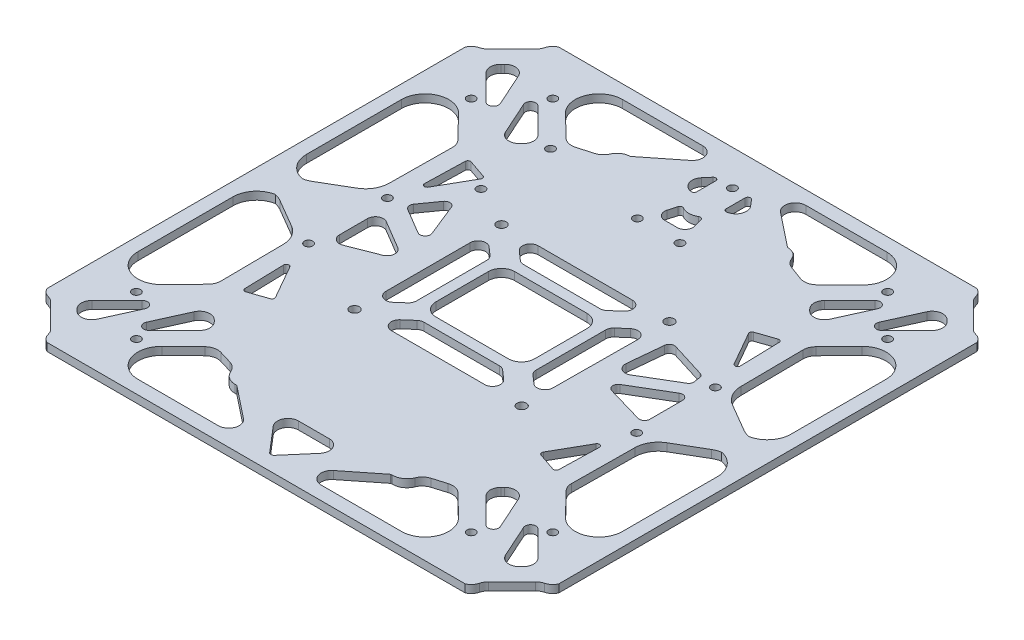
from build123d import *

# Parameters (mm, degrees)
SKETCH2_W                = 195
SKETCH2_H                = 195
BOSS_EXTRUDE1_DEPTH      = 3
CUT_EXTRUDE1_DEPTH       = 138.918454168
CUT_EXTRUDE1_DEPTH_BACK  = 138.918454168
SKETCH3_R                = 1.6
CUT_EXTRUDE2_DEPTH       = 138.918454168
CUT_EXTRUDE2_DEPTH_BACK  = 138.918454168
SKETCH4_R                = 2.11
SKETCH4_R_2              = 1.35
CUT_EXTRUDE3_DEPTH       = 138.918454168
CUT_EXTRUDE3_DEPTH_BACK  = 138.918454168
SKETCH5_R                = 2
CUT_EXTRUDE4_DEPTH       = 138.918454168
CUT_EXTRUDE4_DEPTH_BACK  = 138.918454168
SKETCH6_R                = 1.6
CUT_EXTRUDE5_DEPTH       = 138.918454168
CUT_EXTRUDE5_DEPTH_BACK  = 138.918454168
CUT_EXTRUDE7_DEPTH       = 138.918454168
CUT_EXTRUDE7_DEPTH_BACK  = 138.918454168
SKETCH8_R                = 3
SKETCH9_W                = 5.16198808
SKETCH9_H                = 152.468237428
BOSS_EXTRUDE2_DEPTH      = 3
FILLET1_R                = 9
BOSS_EXTRUDE3_DEPTH      = 3
FILLET2_R                = 9
FILLET3_R                = 4
BOSS_EXTRUDE4_DEPTH      = 3
SKETCH12_W               = 67.185291346
SKETCH12_H               = 7.329006054
SKETCH12_W_2             = 65.807604932
SKETCH12_H_2             = 7.680902366
BOSS_EXTRUDE5_DEPTH      = 3
CUT_EXTRUDE8_DEPTH       = 138.918454168
CUT_EXTRUDE8_DEPTH_BACK  = 138.918454168
SKETCH13_R               = 1.6
SKETCH14_W               = 7.084650063
SKETCH14_H               = 6.320619174
SKETCH14_W_2             = 7.244850247
SKETCH14_H_2             = 7.471829908
SKETCH14_H_3             = 7.337929735
SKETCH14_H_4             = 9.485616487
BOSS_EXTRUDE6_DEPTH      = 3
SKETCH15_W               = 76.15014778
SKETCH15_H               = 29.022259119
BOSS_EXTRUDE7_DEPTH      = 3
CUT_EXTRUDE11_DEPTH      = 138.918454168
CUT_EXTRUDE11_DEPTH_BACK = 138.918454168
SKETCH18_R               = 1.6
SKETCH19_W               = 5.238499816
SKETCH19_H               = 5.48215097
SKETCH19_W_2             = 6.555446642
SKETCH19_H_2             = 6.887367991
SKETCH19_W_3             = 5.693376804
SKETCH19_H_3             = 4.717369352
SKETCH19_W_4             = 5.530708895
SKETCH19_H_4             = 3.253358174
SKETCH19_W_5             = 8.052021565
SKETCH19_H_5             = 7.454416364
SKETCH19_H_6             = 5.907273345
SKETCH19_W_6             = 5.031332607
SKETCH19_H_7             = 4.334328342
SKETCH19_W_7             = 4.364304535
SKETCH19_H_8             = 3.634843179
SKETCH19_W_8             = 5.088021044
SKETCH19_H_9             = 4.815418525
SKETCH19_W_9             = 5.017354085
SKETCH19_H_10            = 5.724023676
SKETCH19_W_10            = 10.097651378
SKETCH19_H_11            = 6.365326346
SKETCH19_W_11            = 13.268814621
SKETCH19_H_12            = 10.097651378
SKETCH19_W_12            = 8.39752449
SKETCH19_H_13            = 7.606810548
SKETCH19_W_13            = 11.084054813
SKETCH19_H_14            = 8.1180962
SKETCH19_W_14            = 4.710280378
SKETCH19_H_15            = 5.7389623
SKETCH19_W_15            = 7.622902871
SKETCH19_H_16            = 6.590378143
SKETCH19_W_16            = 8.877356082
SKETCH19_H_17            = 5.693087053
SKETCH19_W_17            = 11.555067548
SKETCH19_H_18            = 5.886073054
SKETCH19_W_18            = 15.281377101
SKETCH19_H_19            = 7.324501657
SKETCH19_W_19            = 8.760952434
BOSS_EXTRUDE8_DEPTH      = 3
CUT_EXTRUDE13_DEPTH      = 138.918454168
CUT_EXTRUDE13_DEPTH_BACK = 138.918454168
SKETCH21_R               = 1.8
CUT_EXTRUDE14_DEPTH      = 138.918454168
CUT_EXTRUDE14_DEPTH_BACK = 138.918454168
SKETCH22_R               = 1.6
CUT_EXTRUDE15_DEPTH      = 138.918454168
CUT_EXTRUDE15_DEPTH_BACK = 138.918454168
BOSS_EXTRUDE9_DEPTH      = 3
FILLET4_R                = 1
FILLET5_R                = 1
CUT_EXTRUDE12_DEPTH      = 138.918454311
CUT_EXTRUDE12_DEPTH_BACK = 138.918454311
SKETCH20_R               = 1.6


with BuildPart() as part:
    # Sketch2 → Boss-Extrude1 (new body)
    with BuildSketch(Plane(origin=(0, 0, 0), x_dir=(1, 0, 0), z_dir=(0, 1, 0))):
        Rectangle(SKETCH2_W, SKETCH2_H)
    extrude(amount=BOSS_EXTRUDE1_DEPTH)

    # Sketch3 → Cut-Extrude1 (cut, two sides: drawn at the far end of the back side and taken through both)
    with BuildSketch(Plane(origin=(0, 3, 0), x_dir=(1, 0, 0), z_dir=(0, 1, 0)).offset(-CUT_EXTRUDE1_DEPTH_BACK)):
        with Locations(Location((47.5, 41.25, 0), (0, 0, 270))):
            Circle(SKETCH3_R)
        with Locations(Location((47.5, -41.25, 0), (0, 0, 90))):
            Circle(SKETCH3_R)
        with Locations(Location((-47.5, -41.25, 0), (0, 0, 270))):
            Circle(SKETCH3_R)
        with Locations(Location((-47.5, 41.25, 0), (0, 0, 90))):
            Circle(SKETCH3_R)
    extrude(amount=CUT_EXTRUDE1_DEPTH + CUT_EXTRUDE1_DEPTH_BACK, mode=Mode.SUBTRACT)

    # Sketch4 → Cut-Extrude2 (cut, two sides: drawn at the far end of the back side and taken through both)
    with BuildSketch(Plane(origin=(0, 3, 0), x_dir=(1, 0, 0), z_dir=(0, 1, 0)).offset(-CUT_EXTRUDE2_DEPTH_BACK)):
        with Locations(Location((46.123845661, 61.680194847, 0), (0, 0, 90))):
            Circle(SKETCH4_R)
        with Locations(Location((-61.680194847, 46.123845661, 0), (0, 0, 90))):
            Circle(SKETCH4_R)
        with Locations(Location((-77.943650814, 93.5, 0), (0, 0, 270))):
            Circle(SKETCH4_R_2)
        with Locations(Location((-93.5, 77.943650814, 0), (0, 0, 90))):
            Circle(SKETCH4_R_2)
        with Locations(Location((-46.123845661, 61.680194847, 0), (0, 0, 270))):
            Circle(SKETCH4_R)
        with Locations(Location((93.5, 77.943650814, 0), (0, 0, 270))):
            Circle(SKETCH4_R_2)
        with Locations(Location((77.943650814, 93.5, 0), (0, 0, 90))):
            Circle(SKETCH4_R_2)
        with Locations(Location((61.680194847, 46.123845661, 0), (0, 0, 270))):
            Circle(SKETCH4_R)
        with Locations(Location((61.680194847, -46.123845661, 0), (0, 0, 90))):
            Circle(SKETCH4_R)
        with Locations(Location((77.943650814, -93.5, 0), (0, 0, 270))):
            Circle(SKETCH4_R_2)
        with Locations(Location((93.5, -77.943650814, 0), (0, 0, 90))):
            Circle(SKETCH4_R_2)
        with Locations(Location((-46.123845661, -61.680194847, 0), (0, 0, 90))):
            Circle(SKETCH4_R)
        with Locations(Location((-93.5, -77.943650814, 0), (0, 0, 270))):
            Circle(SKETCH4_R_2)
        with Locations(Location((-77.943650814, -93.5, 0), (0, 0, 90))):
            Circle(SKETCH4_R_2)
        with Locations(Location((-61.680194847, -46.123845661, 0), (0, 0, 270))):
            Circle(SKETCH4_R)
        with Locations(Location((46.123845661, -61.680194847, 0), (0, 0, 270))):
            Circle(SKETCH4_R)
    extrude(amount=CUT_EXTRUDE2_DEPTH + CUT_EXTRUDE2_DEPTH_BACK, mode=Mode.SUBTRACT)

    # Sketch5 → Cut-Extrude3 (cut, two sides: drawn at the far end of the back side and taken through both)
    with BuildSketch(Plane(origin=(0, 3, 0), x_dir=(1, 0, 0), z_dir=(0, 1, 0)).offset(-CUT_EXTRUDE3_DEPTH_BACK)):
        with Locations(Location((30, 70, 0), (0, 0, 270))):
            Circle(SKETCH5_R)
        with Locations(Location((15, 70, 0), (0, 0, 270))):
            Circle(SKETCH5_R)
        with Locations(Location((-15, 70, 0), (0, 0, 90))):
            Circle(SKETCH5_R)
        with Locations(Location((-30, 70, 0), (0, 0, 90))):
            Circle(SKETCH5_R)
        with Locations(Location((-30, -70, 0), (0, 0, 270))):
            Circle(SKETCH5_R)
        with Locations(Location((-15, -70, 0), (0, 0, 270))):
            Circle(SKETCH5_R)
        with Locations(Location((15, -70, 0), (0, 0, 90))):
            Circle(SKETCH5_R)
        with Locations(Location((30, -70, 0), (0, 0, 90))):
            Circle(SKETCH5_R)
    extrude(amount=CUT_EXTRUDE3_DEPTH + CUT_EXTRUDE3_DEPTH_BACK, mode=Mode.SUBTRACT)

    # Sketch6 → Cut-Extrude4 (cut, two sides: drawn at the far end of the back side and taken through both)
    with BuildSketch(Plane(origin=(0, 3, 0), x_dir=(1, 0, 0), z_dir=(0, 1, 0)).offset(-CUT_EXTRUDE4_DEPTH_BACK)):
        with Locations(Location((-62.5, 15, 0), (0, 0, 270))):
            Circle(SKETCH6_R)
        with Locations(Location((-62.5, -15, 0), (0, 0, 90))):
            Circle(SKETCH6_R)
        with Locations(Location((62.5, -15, 0), (0, 0, 270))):
            Circle(SKETCH6_R)
        with Locations(Location((62.5, 15, 0), (0, 0, 90))):
            Circle(SKETCH6_R)
    extrude(amount=CUT_EXTRUDE4_DEPTH + CUT_EXTRUDE4_DEPTH_BACK, mode=Mode.SUBTRACT)

    # Sketch7 → Cut-Extrude5 (cut, two sides: drawn at the far end of the back side and taken through both)
    with BuildSketch(Plane(origin=(0, 3, 0), x_dir=(1, 0, 0), z_dir=(0, 1, 0)).offset(-CUT_EXTRUDE5_DEPTH_BACK)):
        with BuildLine():
            Line((-67.1, -15), (-67.099088544, 15.091567253))
            Line((-67.099088544, 15.091567253), (-66.810690491, 44.064798997))
            ThreePointArc((-66.810690491, 44.064798997), (-67.168435752, 45.972460378), (-68.225667159, 47.60016286))
            Line((-68.225667159, 47.60016286), (-92.33801192, 72.39859956))
            ThreePointArc((-92.33801192, 72.39859956), (-93.391805503, 73.22509409), (-94.627179243, 73.742226418))
            ThreePointArc((-94.627179243, 73.742226418), (-96.350328674, 74.657600533), (-97.5, 76.234118714))
            Line((-97.5, 76.234118714), (-97.5, -76.234118714))
            ThreePointArc((-97.5, -76.234118714), (-96.350328674, -74.657600533), (-94.627179243, -73.742226418))
            ThreePointArc((-94.627179243, -73.742226418), (-93.391805503, -73.22509409), (-92.33801192, -72.39859956))
            Line((-92.33801192, -72.39859956), (-68.225667159, -47.60016286))
            ThreePointArc((-68.225667159, -47.60016286), (-67.168435752, -45.972460378), (-66.810690491, -44.064798997))
            Line((-66.810690491, -44.064798997), (-67.099088544, -15.091567253))
            ThreePointArc((-67.099088544, -15.091567253), (-67.09977213, -15.045785894), (-67.1, -15))
        make_face()
        with BuildLine():
            ThreePointArc((-97.5, 79.653182914), (-96.342305944, 81.236642906), (-94.606672429, 82.150523302))
            ThreePointArc((-94.606672429, 82.150523302), (-93.388598506, 82.650187636), (-92.343175799, 83.450475015))
            Line((-92.343175799, 83.450475015), (-83.450475015, 92.343175799))
            ThreePointArc((-83.450475015, 92.343175799), (-82.650187636, 93.388598506), (-82.150523302, 94.606672429))
            ThreePointArc((-82.150523302, 94.606672429), (-81.236642906, 96.342305944), (-79.653182914, 97.5))
            Line((-79.653182914, 97.5), (-97.5, 97.5))
            Line((-97.5, 97.5), (-97.5, 79.653182914))
        make_face()
        with BuildLine():
            ThreePointArc((-94.606672429, -82.150523302), (-96.342305944, -81.236642906), (-97.5, -79.653182914))
            Line((-97.5, -79.653182914), (-97.5, -97.5))
            Line((-97.5, -97.5), (-79.653182914, -97.5))
            ThreePointArc((-79.653182914, -97.5), (-81.236642906, -96.342305944), (-82.150523302, -94.606672429))
            ThreePointArc((-82.150523302, -94.606672429), (-82.650187636, -93.388598506), (-83.450475015, -92.343175799))
            Line((-83.450475015, -92.343175799), (-92.343175799, -83.450475015))
            ThreePointArc((-92.343175799, -83.450475015), (-93.388598506, -82.650187636), (-94.606672429, -82.150523302))
        make_face()
        with BuildLine():
            Line((76.234118714, 97.5), (-76.234118714, 97.5))
            ThreePointArc((-76.234118714, 97.5), (-74.657600533, 96.350328674), (-73.742226418, 94.627179243))
            ThreePointArc((-73.742226418, 94.627179243), (-73.22509409, 93.391805503), (-72.39859956, 92.33801192))
            Line((-72.39859956, 92.33801192), (-48.235759925, 68.843679325))
            ThreePointArc((-48.235759925, 68.843679325), (-45.974176774, 67.580590379), (-43.384060973, 67.618697772))
            Line((-43.384060973, 67.618697772), (-37.791679223, 69.207086879))
            ThreePointArc((-37.791679223, 69.207086879), (-35.871810562, 70.248237651), (-34.578890795, 72.008422039))
            ThreePointArc((-34.578890795, 72.008422039), (-32.734765968, 74.185815942), (-30, 75))
            Line((-30, 75), (30, 75))
            ThreePointArc((30, 75), (32.793489967, 74.146855894), (34.633680134, 71.878565521))
            ThreePointArc((34.633680134, 71.878565521), (35.789643426, 70.16471047), (37.540094628, 69.064951015))
            Line((37.540094628, 69.064951015), (42.799329414, 67.128943555))
            ThreePointArc((42.799329414, 67.128943555), (45.584611872, 66.93434546), (48.039976467, 68.263575121))
            Line((48.039976467, 68.263575121), (72.419857752, 92.340779607))
            ThreePointArc((72.419857752, 92.340779607), (73.231780338, 93.389992898), (73.739189962, 94.615799689))
            ThreePointArc((73.739189962, 94.615799689), (74.653744886, 96.345877542), (76.234118714, 97.5))
        make_face()
        with BuildLine():
            ThreePointArc((-73.742226418, -94.627179243), (-74.657600533, -96.350328674), (-76.234118714, -97.5))
            Line((-76.234118714, -97.5), (76.234118714, -97.5))
            ThreePointArc((76.234118714, -97.5), (74.657600533, -96.350328674), (73.742226418, -94.627179243))
            ThreePointArc((73.742226418, -94.627179243), (73.22509409, -93.391805503), (72.39859956, -92.33801192))
            Line((72.39859956, -92.33801192), (48.235759925, -68.843679325))
            ThreePointArc((48.235759925, -68.843679325), (45.933721874, -67.570555303), (43.304064218, -67.642141429))
            Line((43.304064218, -67.642141429), (38.28462916, -69.158674052))
            ThreePointArc((38.28462916, -69.158674052), (36.361057884, -70.251030176), (35.097048147, -72.066422073))
            ThreePointArc((35.097048147, -72.066422073), (33.072838964, -74.561541483), (30, -75.5))
            Line((30, -75.5), (-30, -75.5))
            ThreePointArc((-30, -75.5), (-33.072838964, -74.561541483), (-35.097048147, -72.066422073))
            ThreePointArc((-35.097048147, -72.066422073), (-36.361057884, -70.251030176), (-38.28462916, -69.158674052))
            Line((-38.28462916, -69.158674052), (-43.304064218, -67.642141429))
            ThreePointArc((-43.304064218, -67.642141429), (-45.933721874, -67.570555303), (-48.235759925, -68.843679325))
            Line((-48.235759925, -68.843679325), (-72.39859956, -92.33801192))
            ThreePointArc((-72.39859956, -92.33801192), (-73.22509409, -93.391805503), (-73.742226418, -94.627179243))
        make_face()
        with BuildLine():
            Line((97.5, 97.5), (79.653182914, 97.5))
            ThreePointArc((79.653182914, 97.5), (81.236642906, 96.342305944), (82.150523302, 94.606672429))
            ThreePointArc((82.150523302, 94.606672429), (82.650187636, 93.388598506), (83.450475015, 92.343175799))
            Line((83.450475015, 92.343175799), (92.343175799, 83.450475015))
            ThreePointArc((92.343175799, 83.450475015), (93.388598506, 82.650187636), (94.606672429, 82.150523302))
            ThreePointArc((94.606672429, 82.150523302), (96.342305944, 81.236642906), (97.5, 79.653182914))
            Line((97.5, 79.653182914), (97.5, 97.5))
        make_face()
        with BuildLine():
            ThreePointArc((82.150523302, -94.606672429), (81.236642906, -96.342305944), (79.653182914, -97.5))
            Line((79.653182914, -97.5), (97.5, -97.5))
            Line((97.5, -97.5), (97.5, -79.653182914))
            ThreePointArc((97.5, -79.653182914), (96.342305944, -81.236642906), (94.606672429, -82.150523302))
            ThreePointArc((94.606672429, -82.150523302), (93.388598506, -82.650187636), (92.343175799, -83.450475015))
            Line((92.343175799, -83.450475015), (83.450475015, -92.343175799))
            ThreePointArc((83.450475015, -92.343175799), (82.650187636, -93.388598506), (82.150523302, -94.606672429))
        make_face()
        with BuildLine():
            ThreePointArc((94.627179243, -73.742226418), (96.350328674, -74.657600533), (97.5, -76.234118714))
            Line((97.5, -76.234118714), (97.5, 76.234118714))
            ThreePointArc((97.5, 76.234118714), (96.350328674, 74.657600533), (94.627179243, 73.742226418))
            ThreePointArc((94.627179243, 73.742226418), (93.391805503, 73.22509409), (92.33801192, 72.39859956))
            Line((92.33801192, 72.39859956), (68.225667159, 47.60016286))
            ThreePointArc((68.225667159, 47.60016286), (67.168435752, 45.972460378), (66.810690491, 44.064798997))
            Line((66.810690491, 44.064798997), (67.099088544, 15.091567253))
            ThreePointArc((67.099088544, 15.091567253), (67.09977213, 15.045785894), (67.1, 15))
            Line((67.1, 15), (67.099088544, -15.091567253))
            Line((67.099088544, -15.091567253), (66.810690491, -44.064798997))
            ThreePointArc((66.810690491, -44.064798997), (67.168435752, -45.972460378), (68.225667159, -47.60016286))
            Line((68.225667159, -47.60016286), (92.33801192, -72.39859956))
            ThreePointArc((92.33801192, -72.39859956), (93.391805503, -73.22509409), (94.627179243, -73.742226418))
        make_face()
    extrude(amount=CUT_EXTRUDE5_DEPTH + CUT_EXTRUDE5_DEPTH_BACK, mode=Mode.SUBTRACT)

    # Sketch8 → Cut-Extrude7 (cut, two sides: drawn at the far end of the back side and taken through both)
    with BuildSketch(Plane(origin=(0, 3, 0), x_dir=(1, 0, 0), z_dir=(0, 1, 0)).offset(-CUT_EXTRUDE7_DEPTH_BACK)):
        with Locations(Location((0, 0, 0), (0, 0, 270))):
            Circle(SKETCH8_R)
        with BuildLine():
            Line((-46.075946512, -21.34896745), (-46.075946512, 21.363521254))
            ThreePointArc((-46.075946512, 21.363521254), (-46.860319172, 22.339996984), (-47.982956213, 21.784630983))
            Line((-47.982956213, 21.784630983), (-56.124255266, 4.249445458))
            ThreePointArc((-56.124255266, 4.249445458), (-57.054155987, 0.045094312), (-56.129928738, -4.160507655))
            Line((-56.129928738, -4.160507655), (-47.98352356, -21.768853033))
            ThreePointArc((-47.98352356, -21.768853033), (-46.860977965, -22.325588422), (-46.075946512, -21.34896745))
        make_face()
        with BuildLine():
            Line((56.124255266, 4.249445458), (47.982956213, 21.784630983))
            ThreePointArc((47.982956213, 21.784630983), (46.860319172, 22.339996984), (46.075946512, 21.363521254))
            Line((46.075946512, 21.363521254), (46.075946512, -21.34896745))
            ThreePointArc((46.075946512, -21.34896745), (46.860977965, -22.325588422), (47.98352356, -21.768853033))
            Line((47.98352356, -21.768853033), (56.129928738, -4.160507655))
            ThreePointArc((56.129928738, -4.160507655), (57.054155987, 0.045094312), (56.124255266, 4.249445458))
        make_face()
        with BuildLine():
            Line((-58.318731361, 26.348348992), (-51.034926184, 39.095008052))
            ThreePointArc((-51.034926184, 39.095008052), (-50.967376772, 39.943698114), (-51.578125125, 40.536845815))
            Line((-51.578125125, 40.536845815), (-58.463843567, 42.903521965))
            ThreePointArc((-58.463843567, 42.903521965), (-59.359048857, 42.779356057), (-59.788541049, 41.984154106))
            Line((-59.788541049, 41.984154106), (-60.186627783, 26.870818896))
            ThreePointArc((-60.186627783, 26.870818896), (-59.456345727, 25.881451512), (-58.318731361, 26.348348992))
        make_face()
        with BuildLine():
            Line((-59.788541049, -41.984154106), (-60.186627783, -26.870818896))
            ThreePointArc((-60.186627783, -26.870818896), (-59.456345727, -25.881451512), (-58.318731361, -26.348348992))
            Line((-58.318731361, -26.348348992), (-51.034926184, -39.095008052))
            ThreePointArc((-51.034926184, -39.095008052), (-50.967376772, -39.943698114), (-51.578125125, -40.536845815))
            Line((-51.578125125, -40.536845815), (-58.463843567, -42.903521965))
            ThreePointArc((-58.463843567, -42.903521965), (-59.359048857, -42.779356057), (-59.788541049, -41.984154106))
        make_face()
        with BuildLine():
            Line((59.788541049, 41.984154106), (60.186627783, 26.870818896))
            ThreePointArc((60.186627783, 26.870818896), (59.456345727, 25.881451512), (58.318731361, 26.348348992))
            Line((58.318731361, 26.348348992), (51.034926184, 39.095008052))
            ThreePointArc((51.034926184, 39.095008052), (50.967376772, 39.943698114), (51.578125125, 40.536845815))
            Line((51.578125125, 40.536845815), (58.463843567, 42.903521965))
            ThreePointArc((58.463843567, 42.903521965), (59.359048857, 42.779356057), (59.788541049, 41.984154106))
        make_face()
        with BuildLine():
            Line((58.318731361, -26.348348992), (51.034926184, -39.095008052))
            ThreePointArc((51.034926184, -39.095008052), (50.967376772, -39.943698114), (51.578125125, -40.536845815))
            Line((51.578125125, -40.536845815), (58.463843567, -42.903521965))
            ThreePointArc((58.463843567, -42.903521965), (59.359048857, -42.779356057), (59.788541049, -41.984154106))
            Line((59.788541049, -41.984154106), (60.186627783, -26.870818896))
            ThreePointArc((60.186627783, -26.870818896), (59.456345727, -25.881451512), (58.318731361, -26.348348992))
        make_face()
        with BuildLine():
            Line((-29.190874416, -41.25), (-22, -41.25))
            ThreePointArc((-22, -41.25), (-17.050252532, -43.300252532), (-15, -48.25))
            Line((-15, -48.25), (-15, -58))
            ThreePointArc((-15, -58), (-17.050252532, -62.949747468), (-22, -65))
            Line((-22, -65), (-23.256091807, -65))
            ThreePointArc((-23.256091807, -65), (-26.685566957, -64.102352022), (-29.235481697, -61.639628628))
            Line((-29.235481697, -61.639628628), (-35.170264305, -51.889628628))
            ThreePointArc((-35.170264305, -51.889628628), (-35.293226438, -44.82052485), (-29.190874416, -41.25))
        make_face()
        with BuildLine():
            Line((29.190874416, 41.25), (22, 41.25))
            ThreePointArc((22, 41.25), (17.050252532, 43.300252532), (15, 48.25))
            Line((15, 48.25), (15, 58))
            ThreePointArc((15, 58), (17.050252532, 62.949747468), (22, 65))
            Line((22, 65), (23.256091807, 65))
            ThreePointArc((23.256091807, 65), (26.685566957, 64.102352022), (29.235481697, 61.639628628))
            Line((29.235481697, 61.639628628), (35.170264305, 51.889628628))
            ThreePointArc((35.170264305, 51.889628628), (35.293226438, 44.82052485), (29.190874416, 41.25))
        make_face()
        with BuildLine():
            Line((29.235481697, -61.639628628), (35.170264305, -51.889628628))
            ThreePointArc((35.170264305, -51.889628628), (35.293226438, -44.82052485), (29.190874416, -41.25))
            Line((29.190874416, -41.25), (22, -41.25))
            ThreePointArc((22, -41.25), (17.050252532, -43.300252532), (15, -48.25))
            Line((15, -48.25), (15, -58))
            ThreePointArc((15, -58), (17.050252532, -62.949747468), (22, -65))
            Line((22, -65), (23.256091807, -65))
            ThreePointArc((23.256091807, -65), (26.685566957, -64.102352022), (29.235481697, -61.639628628))
        make_face()
        with BuildLine():
            Line((-29.235481697, 61.639628628), (-35.170264305, 51.889628628))
            ThreePointArc((-35.170264305, 51.889628628), (-35.293226438, 44.82052485), (-29.190874416, 41.25))
            Line((-29.190874416, 41.25), (-22, 41.25))
            ThreePointArc((-22, 41.25), (-17.050252532, 43.300252532), (-15, 48.25))
            Line((-15, 48.25), (-15, 58))
            ThreePointArc((-15, 58), (-17.050252532, 62.949747468), (-22, 65))
            Line((-22, 65), (-23.256091807, 65))
            ThreePointArc((-23.256091807, 65), (-26.685566957, 64.102352022), (-29.235481697, 61.639628628))
        make_face()
        with BuildLine():
            Line((-55.317751874, 58.143142882), (-54.609127035, 58.851767722))
            ThreePointArc((-54.609127035, 58.851767722), (-53.437554159, 61.680194847), (-54.609127035, 64.508621971))
            Line((-54.609127035, 64.508621971), (-64.215657306, 74.115152242))
            ThreePointArc((-64.215657306, 74.115152242), (-66.766627573, 74.346473303), (-67.453044382, 71.878723174))
            Line((-67.453044382, 71.878723174), (-61.792526027, 59.327138995))
            ThreePointArc((-61.792526027, 59.327138995), (-58.865699631, 57.036815878), (-55.317751874, 58.143142882))
        make_face()
        with BuildLine():
            Line((-84.306093786, 81.480702778), (-85.014718626, 80.772077939))
            ThreePointArc((-85.014718626, 80.772077939), (-86.186291501, 77.943650814), (-85.014718626, 75.115223689))
            Line((-85.014718626, 75.115223689), (-75.408188355, 65.508693418))
            ThreePointArc((-75.408188355, 65.508693418), (-72.857218088, 65.277372358), (-72.170801279, 67.745122487))
            Line((-72.170801279, 67.745122487), (-77.831319634, 80.296706666))
            ThreePointArc((-77.831319634, 80.296706666), (-80.758146029, 82.587029783), (-84.306093786, 81.480702778))
        make_face()
        with BuildLine():
            Line((55.317751874, -58.143142882), (54.609127035, -58.851767722))
            ThreePointArc((54.609127035, -58.851767722), (53.437554159, -61.680194847), (54.609127035, -64.508621971))
            Line((54.609127035, -64.508621971), (64.215657306, -74.115152242))
            ThreePointArc((64.215657306, -74.115152242), (66.766627573, -74.346473303), (67.453044382, -71.878723174))
            Line((67.453044382, -71.878723174), (61.792526027, -59.327138995))
            ThreePointArc((61.792526027, -59.327138995), (58.865699631, -57.036815878), (55.317751874, -58.143142882))
        make_face()
        with BuildLine():
            Line((-32.5, -18.207707646), (-14.5051535, -3.060146984))
            ThreePointArc((-14.5051535, -3.060146984), (-13.081100012, 0), (-14.5051535, 3.060146984))
            Line((-14.5051535, 3.060146984), (-32.5, 18.207707646))
            ThreePointArc((-32.5, 18.207707646), (-36.763580055, 18.774114539), (-39.075946512, 15.147560662))
            Line((-39.075946512, 15.147560662), (-39.075946512, -15.147560662))
            ThreePointArc((-39.075946512, -15.147560662), (-36.763580055, -18.774114539), (-32.5, -18.207707646))
        make_face()
        with BuildLine():
            Line((67.453044382, 71.878723174), (61.792526027, 59.327138995))
            ThreePointArc((61.792526027, 59.327138995), (58.865699631, 57.036815878), (55.317751874, 58.143142882))
            Line((55.317751874, 58.143142882), (54.609127035, 58.851767722))
            ThreePointArc((54.609127035, 58.851767722), (53.437554159, 61.680194847), (54.609127035, 64.508621971))
            Line((54.609127035, 64.508621971), (64.215657306, 74.115152242))
            ThreePointArc((64.215657306, 74.115152242), (66.766627573, 74.346473303), (67.453044382, 71.878723174))
        make_face()
        with BuildLine():
            Line((77.831319634, 80.296706666), (72.170801279, 67.745122487))
            ThreePointArc((72.170801279, 67.745122487), (72.857218088, 65.277372358), (75.408188355, 65.508693418))
            Line((75.408188355, 65.508693418), (85.014718626, 75.115223689))
            ThreePointArc((85.014718626, 75.115223689), (86.186291501, 77.943650814), (85.014718626, 80.772077939))
            Line((85.014718626, 80.772077939), (84.306093786, 81.480702778))
            ThreePointArc((84.306093786, 81.480702778), (80.758146029, 82.587029783), (77.831319634, 80.296706666))
        make_face()
        with BuildLine():
            Line((84.306093786, -81.480702778), (85.014718626, -80.772077939))
            ThreePointArc((85.014718626, -80.772077939), (86.186291501, -77.943650814), (85.014718626, -75.115223689))
            Line((85.014718626, -75.115223689), (75.408188355, -65.508693418))
            ThreePointArc((75.408188355, -65.508693418), (72.857218088, -65.277372358), (72.170801279, -67.745122487))
            Line((72.170801279, -67.745122487), (77.831319634, -80.296706666))
            ThreePointArc((77.831319634, -80.296706666), (80.758146029, -82.587029783), (84.306093786, -81.480702778))
        make_face()
        with BuildLine():
            Line((-67.453044382, -71.878723174), (-61.792526027, -59.327138995))
            ThreePointArc((-61.792526027, -59.327138995), (-58.865699631, -57.036815878), (-55.317751874, -58.143142882))
            Line((-55.317751874, -58.143142882), (-54.609127035, -58.851767722))
            ThreePointArc((-54.609127035, -58.851767722), (-53.437554159, -61.680194847), (-54.609127035, -64.508621971))
            Line((-54.609127035, -64.508621971), (-64.215657306, -74.115152242))
            ThreePointArc((-64.215657306, -74.115152242), (-66.766627573, -74.346473303), (-67.453044382, -71.878723174))
        make_face()
        with BuildLine():
            Line((-77.831319634, -80.296706666), (-72.170801279, -67.745122487))
            ThreePointArc((-72.170801279, -67.745122487), (-72.857218088, -65.277372358), (-75.408188355, -65.508693418))
            Line((-75.408188355, -65.508693418), (-85.014718626, -75.115223689))
            ThreePointArc((-85.014718626, -75.115223689), (-86.186291501, -77.943650814), (-85.014718626, -80.772077939))
            Line((-85.014718626, -80.772077939), (-84.306093786, -81.480702778))
            ThreePointArc((-84.306093786, -81.480702778), (-80.758146029, -82.587029783), (-77.831319634, -80.296706666))
        make_face()
        with BuildLine():
            Line((-20.31441961, 26.25), (-2.575946512, 11.318247329))
            ThreePointArc((-2.575946512, 11.318247329), (0, 10.378394314), (2.575946512, 11.318247329))
            Line((2.575946512, 11.318247329), (20.31441961, 26.25))
            ThreePointArc((20.31441961, 26.25), (21.496171059, 30.681170701), (17.738473098, 33.310146984))
            Line((17.738473098, 33.310146984), (-17.738473098, 33.310146984))
            ThreePointArc((-17.738473098, 33.310146984), (-21.496171059, 30.681170701), (-20.31441961, 26.25))
        make_face()
        with BuildLine():
            Line((32.5, -18.207707646), (14.5051535, -3.060146984))
            ThreePointArc((14.5051535, -3.060146984), (13.081100012, 0), (14.5051535, 3.060146984))
            Line((14.5051535, 3.060146984), (32.5, 18.207707646))
            ThreePointArc((32.5, 18.207707646), (36.763580055, 18.774114539), (39.075946512, 15.147560662))
            Line((39.075946512, 15.147560662), (39.075946512, -15.147560662))
            ThreePointArc((39.075946512, -15.147560662), (36.763580055, -18.774114539), (32.5, -18.207707646))
        make_face()
        with BuildLine():
            Line((17.738473098, -33.310146984), (-17.738473098, -33.310146984))
            ThreePointArc((-17.738473098, -33.310146984), (-21.496171059, -30.681170701), (-20.31441961, -26.25))
            Line((-20.31441961, -26.25), (-2.575946512, -11.318247329))
            ThreePointArc((-2.575946512, -11.318247329), (0, -10.378394314), (2.575946512, -11.318247329))
            Line((2.575946512, -11.318247329), (20.31441961, -26.25))
            ThreePointArc((20.31441961, -26.25), (21.496171059, -30.681170701), (17.738473098, -33.310146984))
        make_face()
    extrude(amount=CUT_EXTRUDE7_DEPTH + CUT_EXTRUDE7_DEPTH_BACK, mode=Mode.SUBTRACT)

    # Sketch9 → Boss-Extrude2 (add)
    with BuildSketch(Plane(origin=(0, 0, 0), x_dir=(1, 0, 0), z_dir=(0, 1, 0))):
        Polygon((-76.234118714, 97.5), (76.234118714, 97.5), (75.78009356, 92.33801192), (-72.39859956, 92.33801192), (-74.953859457, 93.391805503), align=None)
        with Locations((-94.91900596, 0)):
            Rectangle(SKETCH9_W, SKETCH9_H)
        with Locations((94.91900596, 0)):
            Rectangle(SKETCH9_W, SKETCH9_H)
        Polygon((-74.953859457, -93.391805503), (-72.39859956, -92.33801192), (72.39859956, -92.33801192), (75.78009356, -93.391805503), (76.234118714, -97.5), (-76.234118714, -97.5), align=None)
    extrude(amount=BOSS_EXTRUDE2_DEPTH)

    # Fillet1
    fillet1_edges = [part.edges().sort_by_distance(p)[0] for p in [
        (72.417055273, 1.5, -92.33801192),
        (92.33801192, 1.5, -72.39859956),
        (-72.39859956, 1.5, -92.33801192),
        (-92.33801192, 1.5, -72.39859956),
        (-92.33801192, 1.5, 72.39859956),
        (-72.39859956, 1.5, 92.33801192),
        (72.39859956, 1.5, 92.33801192),
        (92.33801192, 1.5, 72.39859956),
    ]]
    fillet(fillet1_edges, radius=FILLET1_R)

    # Sketch10 → Boss-Extrude3 (add)
    with BuildSketch(Plane.XZ):
        Polygon((15, -75), (0.131749864, -92.33801192), (8.131749864, -92.33801192), (30, -75), align=None)
        Polygon((-30, -75), (-8.131749864, -92.33801192), (-0.131749864, -92.33801192), (-15, -75), align=None)
        Polygon((-15, 75), (-0.131749864, 92.33801192), (-8.131749864, 92.33801192), (-30, 75), align=None)
        Polygon((30, 75), (8.131749864, 92.33801192), (0.131749864, 92.33801192), (15, 75), align=None)
        Polygon((-92.33801192, 5), (-92.33801192, -5), (-84.33801192, -5), (-67.099088544, -15.091567253), (-67.099088544, 15.091567253), (-84.33801192, 5), align=None)
        Polygon((92.33801192, -5), (92.33801192, 5), (84.33801192, 5), (67.099088544, 15.091567253), (67.099088544, -15.091567253), (84.33801192, -5), align=None)
    extrude(amount=-BOSS_EXTRUDE3_DEPTH)

    # Fillet2
    # the kernel refuses this fillet: 9 mm, written as the material it adds along each edge
    with BuildSketch(Plane(origin=(84.33801192, 0, 5), x_dir=(-0.8630037712429959, 0, 0.5051974770526539), z_dir=(0, 1, 0)), Plane(origin=(-84.33801192, 0, -5), x_dir=(0.8630037712431919, 0, -0.5051974770523192), z_dir=(0, 1, 0))) as fillet2_piece_1:
        with BuildLine():
            CenterArc((FILLET2_R * 0.271173620178, FILLET2_R), FILLET2_R, 239.655537794, 30.344462206)
            Line((-FILLET2_R * 0.234023856875, FILLET2_R * 0.136996228757), (0, 0))
            Line((0, 0), (FILLET2_R * 0.271173620178, 0))
        make_face()
    extrude(amount=3)
    with BuildSketch(Plane(origin=(92.33801192, 0, 5), x_dir=(0, 0, 1), z_dir=(0, 1, 0)), Plane(origin=(-92.33801192, 0, -5), x_dir=(0, 0, -1), z_dir=(0, 1, 0))) as fillet2_piece_2:
        with BuildLine():
            CenterArc((FILLET2_R, -FILLET2_R), FILLET2_R, 90, 90)
            Line((0, -FILLET2_R), (0, 0))
            Line((0, 0), (FILLET2_R, 0))
        make_face()
    extrude(amount=3)
    with BuildSketch(Plane(origin=(67.099088544, 0, 15.091567253), x_dir=(-0.009953455302394536, 0, 0.9999504631368212), z_dir=(0, 1, 0)), Plane(origin=(67.099088544, 3, -15.091567253), x_dir=(-0.00995345530239279, 0, -0.9999504631368212), z_dir=(0, -1, 0)), Plane(origin=(-67.099088544, 0, -15.091567253), x_dir=(0.009953455302046058, 0, -0.9999504631368247), z_dir=(0, 1, 0))) as fillet2_piece_3:
        with BuildLine():
            CenterArc((FILLET2_R * 0.566755129621, FILLET2_R), FILLET2_R, 210.914762604, 59.085237396)
            Line((-FILLET2_R * 0.291177430616, FILLET2_R * 0.486237679383), (0, 0))
            Line((0, 0), (FILLET2_R * 0.566755129621, 0))
        make_face()
    extrude(amount=3)
    with BuildSketch(Plane(origin=(84.33801192, 0, -5), x_dir=(-0.8630037712431919, 0, -0.5051974770523192), z_dir=(0, 1, 0)), Plane(origin=(-84.33801192, 0, 5), x_dir=(0.8630037712429962, 0, 0.5051974770526534), z_dir=(0, 1, 0))) as fillet2_piece_4:
        with BuildLine():
            CenterArc((FILLET2_R * 0.271173620177, -FILLET2_R), FILLET2_R, 90, 30.344462206)
            Line((-FILLET2_R * 0.234023856875, -FILLET2_R * 0.136996228757), (0, 0))
            Line((0, 0), (FILLET2_R * 0.271173620177, 0))
        make_face()
    extrude(amount=3)
    with BuildSketch(Plane(origin=(92.33801192, 0, -5), x_dir=(0, 0, -1), z_dir=(0, 1, 0)), Plane(origin=(-92.33801192, 0, 5), x_dir=(0, 0, 1), z_dir=(0, 1, 0))) as fillet2_piece_5:
        with BuildLine():
            CenterArc((FILLET2_R, FILLET2_R), FILLET2_R, 180, 90)
            Line((0, FILLET2_R), (0, 0))
            Line((0, 0), (FILLET2_R, 0))
        make_face()
    extrude(amount=3)
    with BuildSketch(Plane(origin=(-67.099088544, 0, 15.091567253), x_dir=(0.009953455302383283, 0, 0.9999504631368213), z_dir=(0, 1, 0))) as fillet2_piece_6:
        with BuildLine():
            CenterArc((FILLET2_R * 0.566755129621, -FILLET2_R), FILLET2_R, 90, 59.085237396)
            Line((-FILLET2_R * 0.291177430616, -FILLET2_R * 0.486237679383), (0, 0))
            Line((0, 0), (FILLET2_R * 0.566755129621, 0))
        make_face()
    extrude(amount=3)

    # Fillet3
    fillet3_edges = [part.edges().sort_by_distance(p)[0] for p in [
        (-14.571223904, 1.5, 75.5),
        (-8.131749864, 1.5, 92.33801192),
        (8.131749864, 1.5, 92.33801192),
        (14.571223904, 1.5, 75.5),
        (15, 1.5, -75),
        (8.131749864, 1.5, -92.33801192),
        (-8.131749864, 1.5, -92.33801192),
        (-15, 1.5, -75),
    ]]
    fillet(fillet3_edges, radius=FILLET3_R)

    # Sketch11 → Boss-Extrude4 (add)
    with BuildSketch(Plane.XZ):
        with BuildLine():
            Line((-1.502465546, 92.33801192), (1.497534454, 92.33801192))
            Line((1.497534454, 92.33801192), (1.497534454, 90.83801192))
            ThreePointArc((1.497534454, 90.83801192), (-0.002465546, 91.809351713), (-1.502465546, 90.83801192))
            Line((-1.502465546, 90.83801192), (-1.502465546, 92.33801192))
        make_face()
        with BuildLine():
            Line((-1.502465546, -92.33801192), (-1.502465546, -90.83801192))
            ThreePointArc((-1.502465546, -90.83801192), (-0.002465546, -91.809351713), (1.497534454, -90.83801192))
            Line((1.497534454, -90.83801192), (1.497534454, -92.33801192))
            Line((1.497534454, -92.33801192), (-1.502465546, -92.33801192))
        make_face()
    extrude(amount=-BOSS_EXTRUDE4_DEPTH)

    # Sketch12 → Boss-Extrude5 (add)
    with BuildSketch(Plane(origin=(0, 0, 0), x_dir=(1, 0, 0), z_dir=(0, 1, 0))):
        with Locations((-0.519806709, -68.837538491)):
            Rectangle(SKETCH12_W, SKETCH12_H)
        with Locations((0.169036498, 70.345364759)):
            Rectangle(SKETCH12_W_2, SKETCH12_H_2)
    extrude(amount=BOSS_EXTRUDE5_DEPTH)

    # Sketch13 → Cut-Extrude8 (cut, two sides: drawn at the far end of the back side and taken through both)
    with BuildSketch(Plane(origin=(0, 3, 0), x_dir=(1, 0, 0), z_dir=(0, 1, 0)).offset(-CUT_EXTRUDE8_DEPTH_BACK)):
        with Locations(Location((-62.5, 9, 0), (0, 0, 270))):
            Circle(SKETCH13_R)
        with Locations(Location((-62.5, -9, 0), (0, 0, 90))):
            Circle(SKETCH13_R)
        with Locations(Location((62.5, -9, 0), (0, 0, 270))):
            Circle(SKETCH13_R)
        with Locations(Location((62.5, 9, 0), (0, 0, 90))):
            Circle(SKETCH13_R)
    extrude(amount=CUT_EXTRUDE8_DEPTH + CUT_EXTRUDE8_DEPTH_BACK, mode=Mode.SUBTRACT)

    # Sketch14 → Boss-Extrude6 (add)
    with BuildSketch(Plane(origin=(0, 3, 0), x_dir=(1, 0, 0), z_dir=(0, 1, 0))):
        with Locations((-46.210776171, -41.637759037)):
            Rectangle(SKETCH14_W, SKETCH14_H)
        with Locations((46.847651561, -41.06215367)):
            Rectangle(SKETCH14_W_2, SKETCH14_H_2)
        with Locations((-46.210776171, 41.649000738)):
            Rectangle(SKETCH14_W, SKETCH14_H_3)
        with Locations((46.847651561, 40.575157362)):
            Rectangle(SKETCH14_W_2, SKETCH14_H_4)
    extrude(amount=-BOSS_EXTRUDE6_DEPTH)

    # Sketch15 → Boss-Extrude7 (add)
    with BuildSketch(Plane(origin=(0, 0, 0), x_dir=(1, 0, 0), z_dir=(0, 1, 0))):
        with Locations((0.036097087, -52.660909868)):
            Rectangle(SKETCH15_W, SKETCH15_H)
        Polygon((58.562577352, -23.055568165), (26.305881429, -23.055568165), (26.305881429, -35.895612173), (-27.246497238, -35.895612173), (-27.246497238, -23.055568165), (-57.937334136, -23.055568165), (-57.937334136, 24.546546207), (-27.246497238, 24.546546207), (-27.246497238, 38.012933825), (-41.652400272, 38.012933825), (-41.652400272, 66.511568087), (40.085440852, 66.511568087), (40.085440852, 38.012933825), (26.305881429, 38.012933825), (26.305881429, 24.546546207), (58.562577352, 24.546546207), align=None)
    extrude(amount=BOSS_EXTRUDE7_DEPTH)

    # Sketch18 → Cut-Extrude11 (cut, two sides: drawn at the far end of the back side and taken through both)
    with BuildSketch(Plane(origin=(0, 3, 0), x_dir=(1, 0, 0), z_dir=(0, 1, 0)).offset(-CUT_EXTRUDE11_DEPTH_BACK)):
        with Locations(Location((-63.80151519, 79.357864376, 0), (0, 0, 270))):
            Circle(SKETCH18_R)
        with Locations(Location((-79.357864376, 63.80151519, 0), (0, 0, 90))):
            Circle(SKETCH18_R)
        with Locations(Location((79.357864376, 63.80151519, 0), (0, 0, 270))):
            Circle(SKETCH18_R)
        with Locations(Location((63.80151519, 79.357864376, 0), (0, 0, 90))):
            Circle(SKETCH18_R)
        with Locations(Location((63.80151519, -79.357864376, 0), (0, 0, 270))):
            Circle(SKETCH18_R)
        with Locations(Location((79.357864376, -63.80151519, 0), (0, 0, 90))):
            Circle(SKETCH18_R)
        with Locations(Location((-79.357864376, -63.80151519, 0), (0, 0, 270))):
            Circle(SKETCH18_R)
        with Locations(Location((-63.80151519, -79.357864376, 0), (0, 0, 90))):
            Circle(SKETCH18_R)
    extrude(amount=CUT_EXTRUDE11_DEPTH + CUT_EXTRUDE11_DEPTH_BACK, mode=Mode.SUBTRACT)

    # Sketch19 → Boss-Extrude8 (add)
    with BuildSketch(Plane(origin=(0, 0, 0), x_dir=(1, 0, 0), z_dir=(0, 1, 0))):
        with Locations((-61.618305822, 46.587138092)):
            Rectangle(SKETCH19_W, SKETCH19_H)
        with Locations((-45.612711524, 60.98741412)):
            Rectangle(SKETCH19_W_2, SKETCH19_H_2)
        with Locations((-77.214664315, 92.9954316)):
            Rectangle(SKETCH19_W_3, SKETCH19_H_3)
        with Locations((-92.586781686, 77.867316093)):
            Rectangle(SKETCH19_W_4, SKETCH19_H_4)
        with Locations((-60.211544948, -46.965989802)):
            Rectangle(SKETCH19_W_5, SKETCH19_H_5)
        with Locations((-45.984069631, -61.637389821)):
            Rectangle(SKETCH19_W_2, SKETCH19_H_6)
        with Locations((-77.545686414, -93.006067954)):
            Rectangle(SKETCH19_W_6, SKETCH19_H_7)
        with Locations((-93.141788602, -77.841979248)):
            Rectangle(SKETCH19_W_7, SKETCH19_H_8)
        with Locations((77.546042003, -93.246613045)):
            Rectangle(SKETCH19_W_8, SKETCH19_H_9)
        with Locations((92.986772535, -77.457580377)):
            Rectangle(SKETCH19_W_9, SKETCH19_H_10)
        with Locations((61.553474555, -46.421444793)):
            Rectangle(SKETCH19_W_10, SKETCH19_H_11)
        with Locations((45.030045028, -60.99526014)):
            Rectangle(SKETCH19_W_11, SKETCH19_H_12)
        with Locations((60.703411111, 47.045158404)):
            Rectangle(SKETCH19_W_12, SKETCH19_H_13)
        with Locations((46.122424932, 61.602778224)):
            Rectangle(SKETCH19_W_13, SKETCH19_H_14)
        with Locations((93.542962139, 78.098810234)):
            Rectangle(SKETCH19_W_14, SKETCH19_H_15)
        with Locations((77.20477986, 92.058927205)):
            Rectangle(SKETCH19_W_15, SKETCH19_H_16)
        with Locations((-62.04751466, -8.748234814)):
            Rectangle(SKETCH19_W_16, SKETCH19_H_17)
        with Locations((-61.963067939, 8.524012347)):
            Rectangle(SKETCH19_W_17, SKETCH19_H_18)
        with Locations((60.614634765, 7.804798046)):
            Rectangle(SKETCH19_W_18, SKETCH19_H_19)
        with Locations((62.221824027, -8.748234814)):
            Rectangle(SKETCH19_W_19, SKETCH19_H_17)
    extrude(amount=BOSS_EXTRUDE8_DEPTH)

    # Sketch21 → Cut-Extrude13 (cut, two sides: drawn at the far end of the back side and taken through both)
    with BuildSketch(Plane(origin=(0, 3, 0), x_dir=(1, 0, 0), z_dir=(0, 1, 0)).offset(-CUT_EXTRUDE13_DEPTH_BACK)):
        with Locations(Location((32, 28, 0), (0, 0, 270))):
            Circle(SKETCH21_R)
        with Locations(Location((31.68590261, -27.999119125, 0), (0, 0, 270))):
            Circle(SKETCH21_R)
        with Locations(Location((-32, -28, 0), (0, 0, 90))):
            Circle(SKETCH21_R)
        with Locations(Location((-32, 28, 0), (0, 0, 90))):
            Circle(SKETCH21_R)
    extrude(amount=CUT_EXTRUDE13_DEPTH + CUT_EXTRUDE13_DEPTH_BACK, mode=Mode.SUBTRACT)

    # Sketch22 → Cut-Extrude14 (cut, two sides: drawn at the far end of the back side and taken through both)
    with BuildSketch(Plane(origin=(0, 3, 0), x_dir=(1, 0, 0), z_dir=(0, 1, 0)).offset(-CUT_EXTRUDE14_DEPTH_BACK)):
        with Locations(Location((-47.66198808, 62.33801192, 0), (0, 0, 270))):
            Circle(SKETCH22_R)
        with Locations(Location((-47.66198808, 35.83801192, 0), (0, 0, 270))):
            Circle(SKETCH22_R)
    extrude(amount=CUT_EXTRUDE14_DEPTH + CUT_EXTRUDE14_DEPTH_BACK, mode=Mode.SUBTRACT)

    # Sketch23 → Cut-Extrude15 (cut, two sides: drawn at the far end of the back side and taken through both)
    with BuildSketch(Plane(origin=(0, 3, 0), x_dir=(1, 0, 0), z_dir=(0, 1, 0)).offset(-CUT_EXTRUDE15_DEPTH_BACK)):
        with BuildLine():
            Line((-2.005404934, 75.401707904), (-5.207598628, 64.329916421))
            ThreePointArc((-5.207598628, 64.329916421), (-4.724132525, 61.69617468), (-2.328406921, 60.5))
            Line((-2.328406921, 60.5), (2.472379565, 60.5))
            ThreePointArc((2.472379565, 60.5), (4.863894301, 61.69058695), (5.355427734, 64.316464879))
            Line((5.355427734, 64.316464879), (2.206550916, 75.397492239))
            ThreePointArc((2.206550916, 75.397492239), (1.458569482, 76.468631065), (0.208848501, 76.849435583))
            ThreePointArc((0.208848501, 76.849435583), (0.073365169, 76.846053283), (-0.06216031, 76.845918994))
            ThreePointArc((-0.06216031, 76.845918994), (-1.277144951, 76.451267337), (-2.005404934, 75.401707904))
        make_face()
        with BuildLine():
            Line((17.941282759, 28), (-17.998150674, 28))
            ThreePointArc((-17.998150674, 28), (-20.804875511, 26.059384579), (-19.980418015, 22.748197124))
            Line((-19.980418015, 22.748197124), (-16.572497958, 19.748197124))
            ThreePointArc((-16.572497958, 19.748197124), (-15.649615197, 19.193275163), (-14.590230618, 19))
            Line((-14.590230618, 19), (14.51271133, 19))
            ThreePointArc((14.51271133, 19), (15.56789135, 19.191691768), (16.488225154, 19.742269916))
            Line((16.488225154, 19.742269916), (19.916796582, 22.742269916))
            ThreePointArc((19.916796582, 22.742269916), (20.749590991, 26.05518002), (17.941282759, 28))
        make_face()
        with BuildLine():
            Line((31.695048927, -16.124928693), (31.916930617, 15.980266635))
            ThreePointArc((31.916930617, 15.980266635), (30.166083727, 18.728598241), (26.941488436, 18.258729475))
            Line((26.941488436, 18.258729475), (23.637474734, 15.367717486))
            ThreePointArc((23.637474734, 15.367717486), (22.881089816, 14.349636249), (22.612988558, 13.109987402))
            Line((22.612988558, 13.109987402), (22.612988558, -13.390987916))
            ThreePointArc((22.612988558, -13.390987916), (22.879236373, -14.626544061), (23.630721217, -15.642790791))
            Line((23.630721217, -15.642790791), (26.712853228, -18.355998813))
            ThreePointArc((26.712853228, -18.355998813), (29.921222912, -18.842201241), (31.695048927, -16.124928693))
        make_face()
        with BuildLine():
            Line((-17.940313989, -28), (17.611139282, -28))
            ThreePointArc((17.611139282, -28), (20.417785464, -26.059592946), (19.593740946, -22.748491474))
            Line((19.593740946, -22.748491474), (16.185486516, -19.748197124))
            ThreePointArc((16.185486516, -19.748197124), (15.262603755, -19.193275163), (14.203219176, -19))
            Line((14.203219176, -19), (-14.511182966, -19))
            ThreePointArc((-14.511182966, -19), (-15.566362986, -19.191691768), (-16.48669679, -19.742269916))
            Line((-16.48669679, -19.742269916), (-19.915689356, -22.742638411))
            ThreePointArc((-19.915689356, -22.742638411), (-20.748425397, -26.055316325), (-17.940313989, -28))
        make_face()
        with BuildLine():
            Line((-32, 16.033232254), (-32, -16.073622414))
            ThreePointArc((-32, -16.073622414), (-30.239772224, -18.805329687), (-27.024834892, -18.331194262))
            Line((-27.024834892, -18.331194262), (-24.024818832, -15.706180209))
            ThreePointArc((-24.024818832, -15.706180209), (-23.268441226, -14.688115087), (-23.000332656, -13.448485518))
            Line((-23.000332656, -13.448485518), (-23.000015997, 13.392303923))
            ThreePointArc((-23.000015997, 13.392303923), (-23.266256523, 14.627879335), (-24.017748656, 15.644142191))
            Line((-24.017748656, 15.644142191), (-27.017732659, 18.28503513))
            ThreePointArc((-27.017732659, 18.28503513), (-30.235556146, 18.766984439), (-32, 16.033232254))
        make_face()
        with BuildLine():
            ThreePointArc((-54.968344656, 7.038932529), (-57.98408793, 7.06658981), (-59.5, 4.459391502))
            Line((-59.5, 4.459391502), (-59.5, -6.221185653))
            ThreePointArc((-59.5, -6.221185653), (-58.192791439, -8.697969281), (-55.410361904, -9.016304401))
            Line((-55.410361904, -9.016304401), (-44.55177513, -4.783235656))
            ThreePointArc((-44.55177513, -4.783235656), (-42.651507416, -2.234009669), (-44.109757882, 0.59142412))
            Line((-44.109757882, 0.59142412), (-54.968344656, 7.038932529))
        make_face()
        with BuildLine():
            ThreePointArc((-14.000056017, 15), (-17.535569068, 13.535554761), (-19.000056017, 10.000058988))
            Line((-19.000056017, 10.000058988), (-19.000291971, -9.999941012))
            ThreePointArc((-19.000291971, -9.999941012), (-17.535846732, -13.53551305), (-14.000291971, -15))
            Line((-14.000291971, -15), (13.612988558, -15))
            ThreePointArc((13.612988558, -15), (17.148522464, -13.535533906), (18.612988558, -10))
            Line((18.612988558, -10), (18.612988558, 10))
            ThreePointArc((18.612988558, 10), (17.148522464, 13.535533906), (13.612988558, 15))
            Line((13.612988558, 15), (-14.000056017, 15))
        make_face()
        with BuildLine():
            ThreePointArc((60.521103563, 4.496465568), (59.510495516, 6.234597773), (57.5, 6.216159585))
            Line((57.5, 6.216159585), (43.367844355, -2.175097422))
            ThreePointArc((43.367844355, -2.175097422), (42.404943949, -4.147235996), (43.831036163, -5.81539928))
            Line((43.831036163, -5.81539928), (57.963191809, -9.92060784))
            ThreePointArc((57.963191809, -9.92060784), (59.72197335, -9.59934729), (60.521103563, -8))
            Line((60.521103563, -8), (60.521103563, 4.496465568))
        make_face()
        with BuildLine():
            ThreePointArc((37.622064719, 5.870839806), (39.021345871, 3.002206331), (42.212696952, 2.953998092))
            Line((42.212696952, 2.953998092), (55.696244579, 10.960130798))
            ThreePointArc((55.696244579, 10.960130798), (56.537356968, 11.950337496), (56.592623837, 13.248384078))
            ThreePointArc((56.592623837, 13.248384078), (56.411120195, 14.056181061), (56.339553992, 14.881019115))
            ThreePointArc((56.339553992, 14.881019115), (55.938781681, 16.043924406), (54.933255676, 16.75236256))
            Line((54.933255676, 16.75236256), (41.505096005, 20.92381036))
            ThreePointArc((41.505096005, 20.92381036), (39.805287902, 20.679891019), (38.921188598, 19.207745424))
            Line((38.921188598, 19.207745424), (37.622064719, 5.870839806))
        make_face()
        with BuildLine():
            ThreePointArc((-55.460048901, 17.990592418), (-55.787724232, 16.417317931), (-54.851975839, 15.110819297))
            Line((-54.851975839, 15.110819297), (-45.202669854, 9.381346137))
            ThreePointArc((-45.202669854, 9.381346137), (-42.879941983, 9.582562574), (-42.32597603, 11.847220283))
            Line((-42.32597603, 11.847220283), (-47.280969975, 24.169229612))
            ThreePointArc((-47.280969975, 24.169229612), (-48.900670698, 25.409089797), (-50.765736861, 24.583128587))
            Line((-50.765736861, 24.583128587), (-55.460048901, 17.990592418))
        make_face()
    extrude(amount=CUT_EXTRUDE15_DEPTH + CUT_EXTRUDE15_DEPTH_BACK, mode=Mode.SUBTRACT)

    # Sketch24 → Boss-Extrude9 (add)
    with BuildSketch(Plane(origin=(0, 0, 0), x_dir=(1, 0, 0), z_dir=(0, 1, 0))):
        with BuildLine():
            Line((-5.6, 73), (-5.6, 92.604459416))
            Line((-5.6, 92.604459416), (5.6, 92.604459416))
            Line((5.6, 92.604459416), (5.6, 73))
            ThreePointArc((5.6, 73), (0, 67.4), (-5.6, 73))
        make_face()
    extrude(amount=BOSS_EXTRUDE9_DEPTH)

    # Fillet4
    fillet4_edges = [part.edges().sort_by_distance(p)[0] for p in [
        (-5.6, 1.5, -85.961431948),
        (-5.6, 1.5, -75),
        (5.6, 1.5, -75),
        (5.6, 1.5, -85.961431948),
    ]]
    fillet(fillet4_edges, radius=FILLET4_R)

    # Fillet5
    fillet5_edges = [part.edges().sort_by_distance(p)[0] for p in [
        (-3.87053339, 1.5, -68.952905823),
        (4.00120145, 1.5, -69.082043012),
    ]]
    fillet(fillet5_edges, radius=FILLET5_R)

    # Sketch20 → Cut-Extrude12 (cut, two sides: drawn at the far end of the back side and taken through both)
    with BuildSketch(Plane(origin=(0, 3, 0), x_dir=(1, 0, 0), z_dir=(0, 1, 0)).offset(-CUT_EXTRUDE12_DEPTH_BACK)):
        with Locations(Location((-8.13, 55.89, 0), (0, 0, 270))):
            Circle(SKETCH20_R)
        with Locations(Location((8.13, 55.89, 0), (0, 0, 90))):
            Circle(SKETCH20_R)
        with Locations(Location((0, 84, 0), (0, 0, 270))):
            Circle(SKETCH20_R)
    extrude(amount=CUT_EXTRUDE12_DEPTH + CUT_EXTRUDE12_DEPTH_BACK, mode=Mode.SUBTRACT)


solid = part.part
